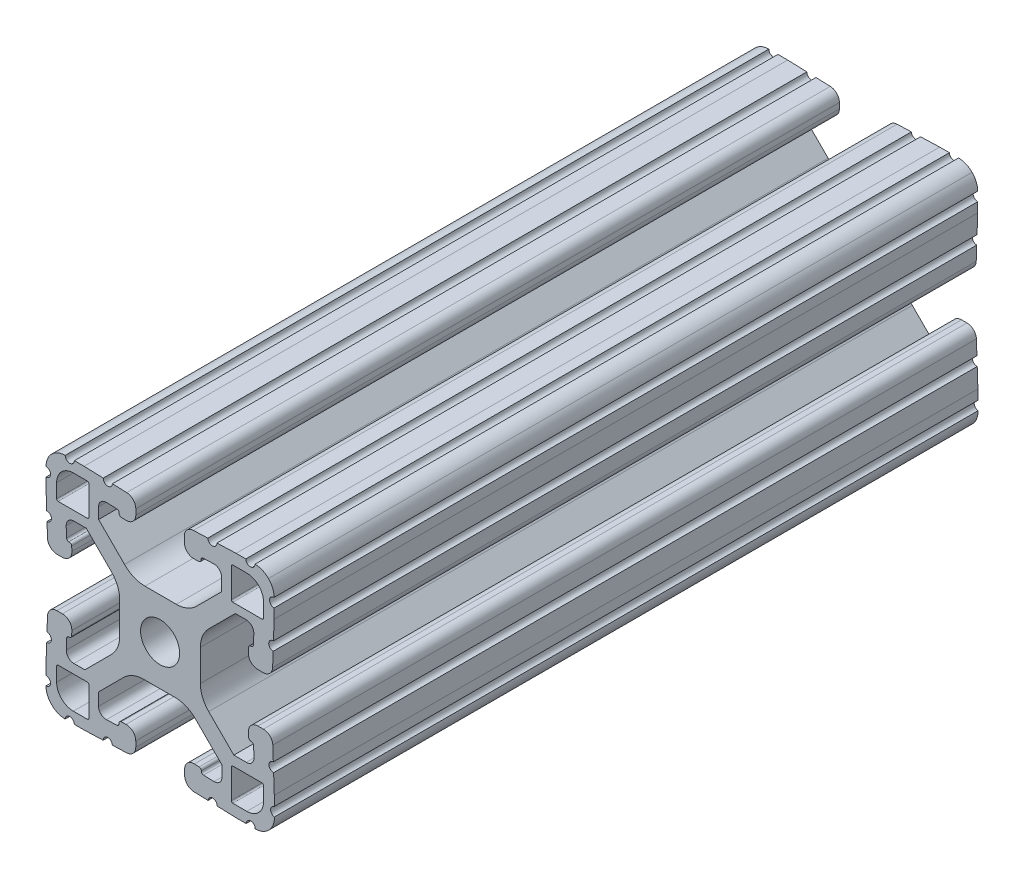
from build123d import *

# Parameters (mm, degrees)
SKETCH1_R           = 3.2639
BOSS_EXTRUDE1_DEPTH = 117.475


with BuildPart() as part:
    # Sketch1 → Boss-Extrude1 (new body)
    with BuildSketch(Plane(origin=(0, 0, -25.4), x_dir=(-1, 0, 0), z_dir=(0, 0, -1))):
        with BuildLine():
            Line((-88.043721549, 91.862643967), (-86.29674679, 91.923648859))
            ThreePointArc((-86.29674679, 91.923648859), (-85.370208675, 91.567983831), (-84.982425017, 90.654422489))
            Line((-84.982425017, 90.654422489), (-84.982425017, 88.800173916))
            Line((-84.982425017, 88.800173916), (-89.306565884, 84.476033049))
            ThreePointArc((-89.306565884, 84.476033049), (-90.866149908, 83.406077005), (-92.719610366, 83.029523439))
            Line((-92.719610366, 83.029523439), (-97.961628589, 83.029523439))
            ThreePointArc((-97.961628589, 83.029523439), (-99.779298356, 83.391080435), (-101.320244378, 84.42070765))
            Line((-101.320244378, 84.42070765), (-105.516001761, 88.616465033))
            Line((-105.516001761, 88.616465033), (-105.516001761, 90.731330035))
            ThreePointArc((-105.516001761, 90.731330035), (-105.128218103, 91.644891377), (-104.201679988, 92.000556406))
            Line((-104.201679988, 92.000556406), (-102.454705229, 91.939551513))
            ThreePointArc((-102.454705229, 91.939551513), (-102.193933359, 91.823448504), (-102.087001761, 91.558783602))
            ThreePointArc((-102.087001761, 91.558783602), (-102.010859042, 91.249291513), (-101.726191901, 91.105946874))
            Line((-101.726191901, 91.105946874), (-100.929727576, 91.078102142))
            ThreePointArc((-100.929727576, 91.078102142), (-99.780779944, 91.519102656), (-99.299905511, 92.651940638))
            Line((-99.299905511, 92.651940638), (-99.299905511, 93.566848638))
            ThreePointArc((-99.299905511, 93.566848638), (-99.741889517, 94.660796975), (-100.819746715, 95.140689345))
            Line((-100.819746715, 95.140689345), (-103.211918901, 95.224224422))
            ThreePointArc((-103.211918901, 95.224224422), (-104.000045777, 94.489281495), (-104.734990687, 95.277406522))
            Line((-104.734990687, 95.277406522), (-107.935905676, 95.389166912))
            Line((-107.935905676, 95.389166912), (-109.561454876, 95.389166912))
            ThreePointArc((-109.561454876, 95.389166912), (-110.323454876, 94.627166912), (-111.085454876, 95.389166912))
            ThreePointArc((-111.085454876, 95.389166912), (-112.308767787, 95.144035599), (-113.343184761, 94.446493225))
            ThreePointArc((-113.343184761, 94.446493225), (-114.04072548, 93.412075135), (-114.285854836, 92.188761832))
            ThreePointArc((-114.285854836, 92.188761832), (-113.523853616, 91.426762441), (-114.285853616, 90.664761832))
            Line((-114.285853616, 90.664761832), (-114.285853616, 89.039212632))
            Line((-114.285853616, 89.039212632), (-114.174093219, 85.838297643))
            ThreePointArc((-114.174093219, 85.838297643), (-113.385968191, 85.103352735), (-114.120911115, 84.315225857))
            Line((-114.120911115, 84.315225857), (-114.037376031, 81.923053667))
            ThreePointArc((-114.037376031, 81.923053667), (-113.55748366, 80.845196472), (-112.463535325, 80.403212468))
            Line((-112.463535325, 80.403212468), (-111.548627325, 80.403212468))
            ThreePointArc((-111.548627325, 80.403212468), (-110.415788905, 80.884087354), (-109.974788872, 82.033035791))
            Line((-109.974788872, 82.033035791), (-110.002634241, 82.829500094))
            ThreePointArc((-110.002634241, 82.829500094), (-110.118742417, 83.090261917), (-110.383401914, 83.197188))
            ThreePointArc((-110.383401914, 83.197188), (-110.693757401, 83.272605688), (-110.837665276, 83.557735272))
            Line((-110.837665276, 83.557735272), (-110.898671566, 85.304709982))
            ThreePointArc((-110.898671566, 85.304709982), (-110.543006925, 86.231248747), (-109.62944523, 86.61903277))
            Line((-109.62944523, 86.61903277), (-107.807161806, 86.61903277))
            Line((-107.807161806, 86.61903277), (-103.364925613, 82.176810793))
            ThreePointArc((-103.364925613, 82.176810793), (-102.335294479, 80.635862907), (-101.973736029, 78.81818963))
            Line((-101.973736029, 78.81818963), (-101.973736029, 73.576034207))
            ThreePointArc((-101.973736029, 73.576034207), (-102.335293752, 71.758362684), (-103.364922926, 70.21741573))
            Line((-103.364922926, 70.21741573), (-107.560683666, 66.021661704))
            Line((-107.560683666, 66.021661704), (-109.652436558, 66.021661704))
            ThreePointArc((-109.652436558, 66.021661704), (-110.565998503, 66.409445617), (-110.921663765, 67.335984343))
            Line((-110.921663765, 67.335984343), (-110.860658873, 69.082959102))
            ThreePointArc((-110.860658873, 69.082959102), (-110.744555864, 69.343730973), (-110.479890961, 69.45066257))
            ThreePointArc((-110.479890961, 69.45066257), (-110.173494703, 69.529390272), (-110.032185196, 69.812424443))
            Line((-110.032185196, 69.812424443), (-110.004340464, 70.608888768))
            ThreePointArc((-110.004340464, 70.608888768), (-110.445340978, 71.7578364), (-111.57817896, 72.238710833))
            Line((-111.57817896, 72.238710833), (-112.49308696, 72.238710833))
            ThreePointArc((-112.49308696, 72.238710833), (-113.587035297, 71.796726827), (-114.066927667, 70.718869629))
            Line((-114.066927667, 70.718869629), (-114.150462744, 68.326697443))
            ThreePointArc((-114.150462744, 68.326697443), (-113.415519817, 67.538570567), (-114.203644843, 66.803625657))
            Line((-114.203644843, 66.803625657), (-114.315405233, 63.602710668))
            Line((-114.315405233, 63.602710668), (-114.315405233, 61.962557497))
            ThreePointArc((-114.315405233, 61.962557497), (-113.701927281, 61.206106537), (-114.333208228, 60.464447842))
            ThreePointArc((-114.333208228, 60.464447842), (-114.113020459, 59.176546471), (-113.392816136, 58.086372941))
            ThreePointArc((-113.392816136, 58.086372941), (-112.358398046, 57.388832223), (-111.135084743, 57.143702867))
            ThreePointArc((-111.135084743, 57.143702867), (-110.373085352, 57.905704086), (-109.611084743, 57.143704086))
            Line((-109.611084743, 57.143704086), (-107.985535543, 57.143704086))
            Line((-107.985535543, 57.143704086), (-104.784620554, 57.255464483))
            ThreePointArc((-104.784620554, 57.255464483), (-104.049675645, 58.04358951), (-103.261548768, 57.308646586))
            Line((-103.261548768, 57.308646586), (-100.869376578, 57.39218167))
            ThreePointArc((-100.869376578, 57.39218167), (-99.791519383, 57.872074041), (-99.349535378, 58.966022376))
            Line((-99.349535378, 58.966022376), (-99.349535378, 59.880930376))
            ThreePointArc((-99.349535378, 59.880930376), (-99.830409811, 61.013768358), (-100.979357443, 61.454768873))
            Line((-100.979357443, 61.454768873), (-101.775821768, 61.42692414))
            ThreePointArc((-101.775821768, 61.42692414), (-102.036583684, 61.310816174), (-102.143509978, 61.046156762))
            ThreePointArc((-102.143509978, 61.046156762), (-102.222494916, 60.740061862), (-102.505377386, 60.598958297))
            Line((-102.505377386, 60.598958297), (-104.252352145, 60.537953405))
            ThreePointArc((-104.252352145, 60.537953405), (-105.17889026, 60.893618433), (-105.566673918, 61.807179775))
            Line((-105.566673918, 61.807179775), (-105.566673918, 63.629462758))
            Line((-105.566673918, 63.629462758), (-101.131142468, 68.064994208))
            ThreePointArc((-101.131142468, 68.064994208), (-99.590196446, 69.094621422), (-97.772526678, 69.456178419))
            Line((-97.772526678, 69.456178419), (-92.530356056, 69.456178419))
            ThreePointArc((-92.530356056, 69.456178419), (-90.712686289, 69.094621422), (-89.171740267, 68.064994208))
            Line((-89.171740267, 68.064994208), (-84.975982884, 63.869236825))
            Line((-84.975982884, 63.869236825), (-84.975982884, 61.781050107))
            ThreePointArc((-84.975982884, 61.781050107), (-85.363766542, 60.867488765), (-86.290304657, 60.511823736))
            Line((-86.290304657, 60.511823736), (-88.037279416, 60.572828629))
            ThreePointArc((-88.037279416, 60.572828629), (-88.298051286, 60.688931638), (-88.404982884, 60.95359654))
            ThreePointArc((-88.404982884, 60.95359654), (-88.466593694, 61.278962759), (-88.759626911, 61.433204782))
            Line((-88.759626911, 61.433204782), (-89.556091237, 61.461049514))
            ThreePointArc((-89.556091237, 61.461049514), (-90.705038868, 61.020049), (-91.185913301, 59.887211018))
            Line((-91.185913301, 59.887211018), (-91.185913301, 58.972303018))
            ThreePointArc((-91.185913301, 58.972303018), (-90.743929295, 57.878354681), (-89.666072098, 57.398462311))
            Line((-89.666072098, 57.398462311), (-87.273899911, 57.314927234))
            ThreePointArc((-87.273899911, 57.314927234), (-86.485773036, 58.049870161), (-85.750828126, 57.261745135))
            Line((-85.750828126, 57.261745135), (-82.549913136, 57.149984745))
            Line((-82.549913136, 57.149984745), (-80.924363936, 57.149984745))
            ThreePointArc((-80.924363936, 57.149984745), (-80.162363936, 57.911984745), (-79.400363936, 57.149984745))
            ThreePointArc((-79.400363936, 57.149984745), (-78.177051025, 57.395116058), (-77.142634052, 58.092658432))
            ThreePointArc((-77.142634052, 58.092658432), (-76.445094372, 59.127074031), (-76.199963977, 60.350384428))
            ThreePointArc((-76.199963977, 60.350384428), (-76.961961268, 61.112385783), (-76.199961268, 61.874384428))
            Line((-76.199961268, 61.874384428), (-76.199961268, 63.499933628))
            Line((-76.199961268, 63.499933628), (-76.311721666, 66.700848617))
            ThreePointArc((-76.311721666, 66.700848617), (-77.099846694, 67.435793525), (-76.364903769, 68.223920403))
            Line((-76.364903769, 68.223920403), (-76.448438853, 70.616092593))
            ThreePointArc((-76.448438853, 70.616092593), (-76.928331225, 71.693949788), (-78.02227956, 72.135933792))
            Line((-78.02227956, 72.135933792), (-78.93718756, 72.135933792))
            ThreePointArc((-78.93718756, 72.135933792), (-80.07002598, 71.655058906), (-80.511026012, 70.506110469))
            Line((-80.511026012, 70.506110469), (-80.483180643, 69.709646166))
            ThreePointArc((-80.483180643, 69.709646166), (-80.367072468, 69.448884343), (-80.102412971, 69.34195826))
            ThreePointArc((-80.102412971, 69.34195826), (-79.796317908, 69.262973649), (-79.655214052, 68.980091239))
            Line((-79.655214052, 68.980091239), (-79.594207761, 67.233116529))
            ThreePointArc((-79.594207761, 67.233116529), (-79.949872402, 66.306577764), (-80.863434097, 65.918793741))
            Line((-80.863434097, 65.918793741), (-82.685717521, 65.918793741))
            Line((-82.685717521, 65.918793741), (-87.121258001, 70.35431293))
            ThreePointArc((-87.121258001, 70.35431293), (-88.150863946, 71.895196205), (-88.512450271, 73.712794894))
            Line((-88.512450271, 73.712794894), (-88.512606864, 78.954950317))
            ThreePointArc((-88.512606864, 78.954950317), (-88.151076291, 80.772698182), (-87.121419968, 82.313710679))
            Line((-87.121419968, 82.313710679), (-82.925659228, 86.509464706))
            Line((-82.925659228, 86.509464706), (-80.837473527, 86.509464706))
            ThreePointArc((-80.837473527, 86.509464706), (-79.923911584, 86.121680793), (-79.568246321, 85.195142068))
            Line((-79.568246321, 85.195142068), (-79.629251214, 83.448167309))
            ThreePointArc((-79.629251214, 83.448167309), (-79.745354223, 83.187395438), (-80.010019125, 83.080463841))
            ThreePointArc((-80.010019125, 83.080463841), (-80.335385344, 83.018853031), (-80.489627367, 82.725819813))
            Line((-80.489627367, 82.725819813), (-80.5174721, 81.929355488))
            ThreePointArc((-80.5174721, 81.929355488), (-80.076471586, 80.780407856), (-78.943633603, 80.299533423))
            Line((-78.943633603, 80.299533423), (-78.028725603, 80.299533423))
            ThreePointArc((-78.028725603, 80.299533423), (-76.934777267, 80.741517429), (-76.454884897, 81.819374627))
            Line((-76.454884897, 81.819374627), (-76.37134982, 84.211546813))
            ThreePointArc((-76.37134982, 84.211546813), (-77.106292747, 84.999673689), (-76.31816772, 85.734618599))
            Line((-76.31816772, 85.734618599), (-76.20640733, 88.935533588))
            Line((-76.20640733, 88.935533588), (-76.20640733, 90.561082788))
            ThreePointArc((-76.20640733, 90.561082788), (-76.96840733, 91.323083398), (-76.206406111, 92.085082788))
            ThreePointArc((-76.206406111, 92.085082788), (-76.451535467, 93.308396091), (-77.149076185, 94.342814181))
            ThreePointArc((-77.149076185, 94.342814181), (-78.183493159, 95.040356555), (-79.40680607, 95.285487868))
            ThreePointArc((-79.40680607, 95.285487868), (-80.16880607, 94.523487868), (-80.93080607, 95.285487868))
            Line((-80.93080607, 95.285487868), (-82.55635527, 95.285487868))
            Line((-82.55635527, 95.285487868), (-85.757270259, 95.173727471))
            ThreePointArc((-85.757270259, 95.173727471), (-86.492215168, 94.385602444), (-87.280342045, 95.120545368))
            Line((-87.280342045, 95.120545368), (-89.672514235, 95.037010285))
            ThreePointArc((-89.672514235, 95.037010285), (-90.75037143, 94.557117913), (-91.192355435, 93.463169578))
            Line((-91.192355435, 93.463169578), (-91.192355435, 92.548261578))
            ThreePointArc((-91.192355435, 92.548261578), (-90.711481002, 91.415423596), (-89.56253337, 90.974423082))
            Line((-89.56253337, 90.974423082), (-88.766069045, 91.002267814))
            ThreePointArc((-88.766069045, 91.002267814), (-88.505307129, 91.11837578), (-88.398380835, 91.383035192))
            ThreePointArc((-88.398380835, 91.383035192), (-88.336765486, 91.708407548), (-88.043721549, 91.862643967))
        make_face()
        with Locations((-95.25, 76.2)):
            Circle(SKETCH1_R, mode=Mode.SUBTRACT)
        with BuildLine():
            Line((-83.357745393, 88.294108398), (-83.357745393, 93.170908398))
            ThreePointArc((-83.357745393, 93.170908398), (-83.283351492, 93.350512545), (-83.103748154, 93.424908398))
            Line((-83.103748154, 93.424908398), (-80.766975763, 93.424933798))
            ThreePointArc((-80.766975763, 93.424933798), (-78.791299784, 92.606600882), (-77.972945393, 90.630933798))
            Line((-77.972945393, 90.630933798), (-77.972945393, 88.294108398))
            ThreePointArc((-77.972945393, 88.294108398), (-78.047340271, 88.114503276), (-78.226945393, 88.040108398))
            Line((-78.226945393, 88.040108398), (-83.103745393, 88.040108398))
            ThreePointArc((-83.103745393, 88.040108398), (-83.283350516, 88.114503276), (-83.357745393, 88.294108398))
        make_face(mode=Mode.SUBTRACT)
        with BuildLine():
            Line((-83.357745393, 59.229091602), (-83.357745393, 64.105891602))
            ThreePointArc((-83.357745393, 64.105891602), (-83.283350516, 64.285496724), (-83.103745393, 64.359891602))
            Line((-83.103745393, 64.359891602), (-78.226945393, 64.359891602))
            ThreePointArc((-78.226945393, 64.359891602), (-78.047340271, 64.285496724), (-77.972945393, 64.105891602))
            Line((-77.972945393, 64.105891602), (-77.972945393, 61.769066202))
            ThreePointArc((-77.972945393, 61.769066202), (-78.791299784, 59.793399118), (-80.766975763, 58.975066202))
            Line((-80.766975763, 58.975066202), (-83.103748154, 58.975091602))
            ThreePointArc((-83.103748154, 58.975091602), (-83.283351492, 59.049487455), (-83.357745393, 59.229091602))
        make_face(mode=Mode.SUBTRACT)
        with BuildLine():
            Line((-107.142254607, 93.170908398), (-107.142254607, 88.294108398))
            ThreePointArc((-107.142254607, 88.294108398), (-107.216649484, 88.114503276), (-107.396254607, 88.040108398))
            Line((-107.396254607, 88.040108398), (-112.273054607, 88.040108398))
            ThreePointArc((-112.273054607, 88.040108398), (-112.452659729, 88.114503276), (-112.527054607, 88.294108398))
            Line((-112.527054607, 88.294108398), (-112.527054607, 90.630933798))
            ThreePointArc((-112.527054607, 90.630933798), (-111.708700216, 92.606600882), (-109.733024237, 93.424933798))
            Line((-109.733024237, 93.424933798), (-107.396251846, 93.424908398))
            ThreePointArc((-107.396251846, 93.424908398), (-107.216648508, 93.350512545), (-107.142254607, 93.170908398))
        make_face(mode=Mode.SUBTRACT)
        with BuildLine():
            Line((-107.142254607, 64.105891602), (-107.142254607, 59.229091602))
            ThreePointArc((-107.142254607, 59.229091602), (-107.216648508, 59.049487455), (-107.396251846, 58.975091602))
            Line((-107.396251846, 58.975091602), (-109.733024237, 58.975066202))
            ThreePointArc((-109.733024237, 58.975066202), (-111.708700216, 59.793399118), (-112.527054607, 61.769066202))
            Line((-112.527054607, 61.769066202), (-112.527054607, 64.105891602))
            ThreePointArc((-112.527054607, 64.105891602), (-112.452659729, 64.285496724), (-112.273054607, 64.359891602))
            Line((-112.273054607, 64.359891602), (-107.396254607, 64.359891602))
            ThreePointArc((-107.396254607, 64.359891602), (-107.216649484, 64.285496724), (-107.142254607, 64.105891602))
        make_face(mode=Mode.SUBTRACT)
    extrude(amount=-BOSS_EXTRUDE1_DEPTH)


solid = part.part
